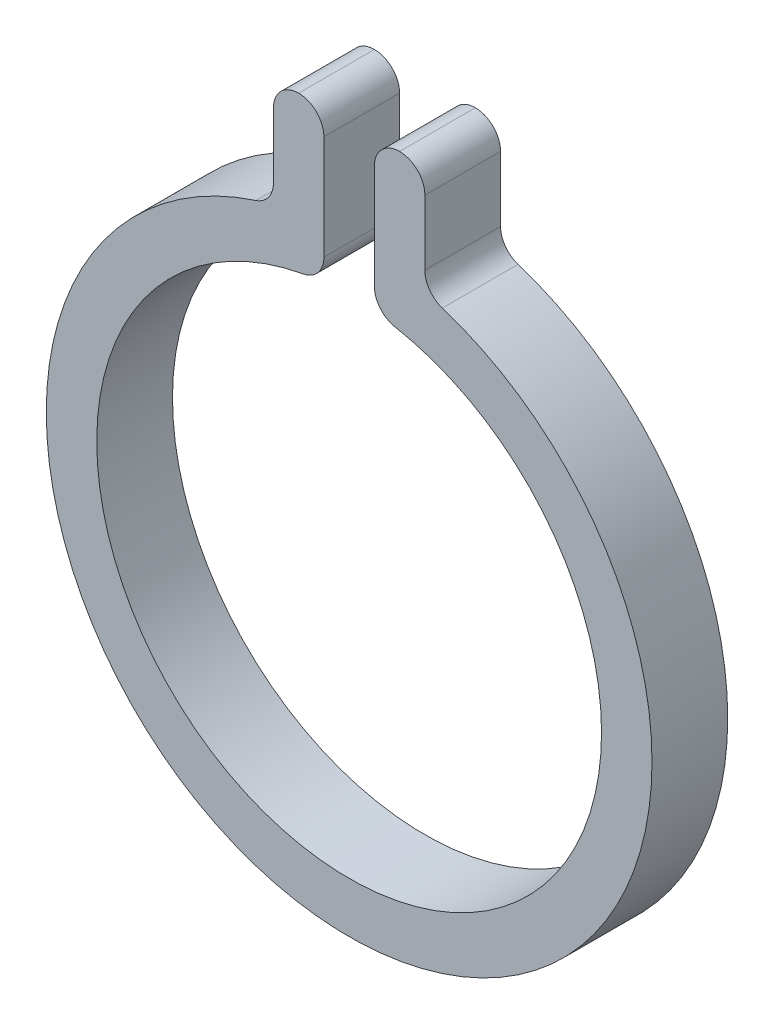
from build123d import *

# Parameters (mm, degrees)
BOSS_EXTRUDE1_DEPTH = 6
FILLET1_R           = 2


with BuildPart() as part:
    # Sketch1 → Boss-Extrude1 (new body)
    with BuildSketch(Plane.XY):
        with BuildLine():
            Line((-6, 23.237900077), (-6, 31.891873593))
            Line((-6, 31.891873593), (-2, 31.891873593))
            Line((-2, 31.891873593), (-2, 19.899748742))
            ThreePointArc((-2, 19.899748742), (0, -20), (2, 19.899748742))
            Line((2, 19.899748742), (2, 31.891873593))
            Line((2, 31.891873593), (6, 31.891873593))
            Line((6, 31.891873593), (6, 23.237900077))
            ThreePointArc((6, 23.237900077), (0, -24), (-6, 23.237900077))
        make_face()
    extrude(amount=BOSS_EXTRUDE1_DEPTH)

    # Fillet1
    fillet1_edges = [part.edges().sort_by_distance(p)[0] for p in [
        (-2, 19.899748742, 3),
        (2, 19.899748742, 3),
        (6, 23.237900077, 3),
        (-6, 23.237900077, 3),
        (6, 31.891873593, 3),
        (2, 31.891873593, 3),
        (-2, 31.891873593, 3),
        (-6, 31.891873593, 3),
    ]]
    fillet(fillet1_edges, radius=FILLET1_R - 0.0001)  # a hair under: the kernel refuses the full size


solid = part.part
